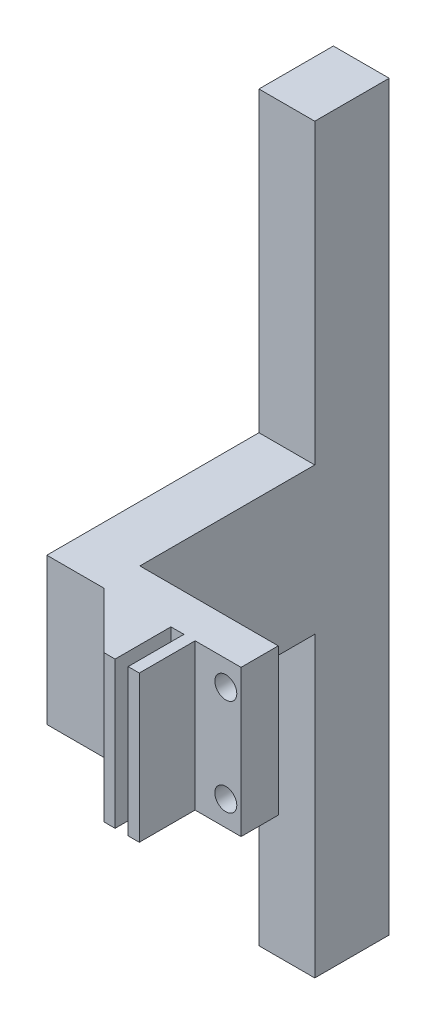
from build123d import *

# Parameters (mm, degrees)
SKETCH1_R           = 2.95
BOSS_EXTRUDE1_DEPTH = 10
SKETCH3_W           = 3
SKETCH3_H           = 39.4
BOSS_EXTRUDE2_DEPTH = 15
SKETCH4_W           = 10
SKETCH4_H           = 39.4
BOSS_EXTRUDE3_DEPTH = 3
SKETCH5_W           = 15
SKETCH5_H           = 39.4
BOSS_EXTRUDE4_DEPTH = 77
SKETCH6_W           = 15
SKETCH6_H           = 20
BOSS_EXTRUDE5_DEPTH = 80
SKETCH7_W           = 15
SKETCH7_H           = 20
BOSS_EXTRUDE6_DEPTH = 80
CHAMFER1_SIZE       = 15


with BuildPart() as part:
    # Sketch1 → Boss-Extrude1 (new body)
    with BuildSketch(Plane.XY):
        Polygon((17.098195917, 0), (7.098195917, 0), (-7.0982035, 0), (-17.0982035, 0), (-17.0982035, -39.4), (17.098195917, -39.4), align=None)
        with Locations((-13, -32.7)):
            Circle(SKETCH1_R, mode=Mode.SUBTRACT)
        with Locations((13, -32.7)):
            Circle(SKETCH1_R, mode=Mode.SUBTRACT)
        with Locations((-13, -6.7)):
            Circle(SKETCH1_R, mode=Mode.SUBTRACT)
        with Locations((13, -6.7)):
            Circle(SKETCH1_R, mode=Mode.SUBTRACT)
    extrude(amount=BOSS_EXTRUDE1_DEPTH)

    # Sketch3 → Boss-Extrude2 (add)
    with BuildSketch(Plane.XY.offset(10)):
        with Locations((3.249996208, -19.7)):
            Rectangle(SKETCH3_W, SKETCH3_H)
        with Locations((-3.250003792, -19.7)):
            Rectangle(SKETCH3_W, SKETCH3_H)
    extrude(amount=BOSS_EXTRUDE2_DEPTH)

    # Sketch4 → Boss-Extrude3 (add)
    with BuildSketch(Plane(origin=(-17.0982035, 0, 0), x_dir=(0, 0, -1), z_dir=(1, 0, 0))):
        with Locations((-5, -19.7)):
            Rectangle(SKETCH4_W, SKETCH4_H)
    extrude(amount=-BOSS_EXTRUDE3_DEPTH)

    # Sketch5 → Boss-Extrude4 (add)
    with BuildSketch(Plane.XY.offset(10)):
        with Locations((-27.5982035, -19.7)):
            Rectangle(SKETCH5_W, SKETCH5_H)
    extrude(amount=-BOSS_EXTRUDE4_DEPTH)

    # Sketch6 → Boss-Extrude5 (add)
    with BuildSketch(Plane(origin=(0, 0, 0), x_dir=(1, 0, 0), z_dir=(0, 1, 0))):
        with Locations((-27.5982035, 57)):
            Rectangle(SKETCH6_W, SKETCH6_H)
    extrude(amount=BOSS_EXTRUDE5_DEPTH)

    # Sketch7 → Boss-Extrude6 (add)
    with BuildSketch(Plane(origin=(0, -39.4, 0), x_dir=(-1, 0, 0), z_dir=(0, -1, 0))):
        with Locations((27.5982035, 57)):
            Rectangle(SKETCH7_W, SKETCH7_H)
    extrude(amount=BOSS_EXTRUDE6_DEPTH)

    # Chamfer1
    # the kernel refuses this chamfer: 15 mm, written as the material it adds along each edge
    with BuildSketch(Plane(origin=(-4.750003792, 0, 10), x_dir=(0.02749587661058638, 0, 0.9996219169112968), z_dir=(0, -1, 0))) as chamfer1_piece_1_section:
        Polygon((CHAMFER1_SIZE * 0.999621916911, CHAMFER1_SIZE * 0.0274958766106), (-CHAMFER1_SIZE * 0.0274958766106, CHAMFER1_SIZE * 0.999621916911), (0, 0), align=None)
    chamfer1_piece_1 = extrude(amount=39.4, mode=Mode.PRIVATE)
    chamfer1_piece_1 = split(chamfer1_piece_1, bisect_by=Plane(origin=(-9.447589606, -19.699993032, 25), z_dir=(0, 0, -1)), keep=Keep.TOP, mode=Mode.PRIVATE)
    chamfer1_piece_1 = chamfer1_piece_1 - Plane(origin=(-13, -32.7, 15.064326231), x_dir=(1, 0, 0), z_dir=(0, 0, -1)) * Cylinder(2.95, 139, mode=Mode.PRIVATE)
    chamfer1_piece_1 = chamfer1_piece_1 - Plane(origin=(-13, -6.7, 15.064326231), x_dir=(1, 0, 0), z_dir=(0, 0, -1)) * Cylinder(2.95, 139, mode=Mode.PRIVATE)
    add(chamfer1_piece_1)


solid = part.part
